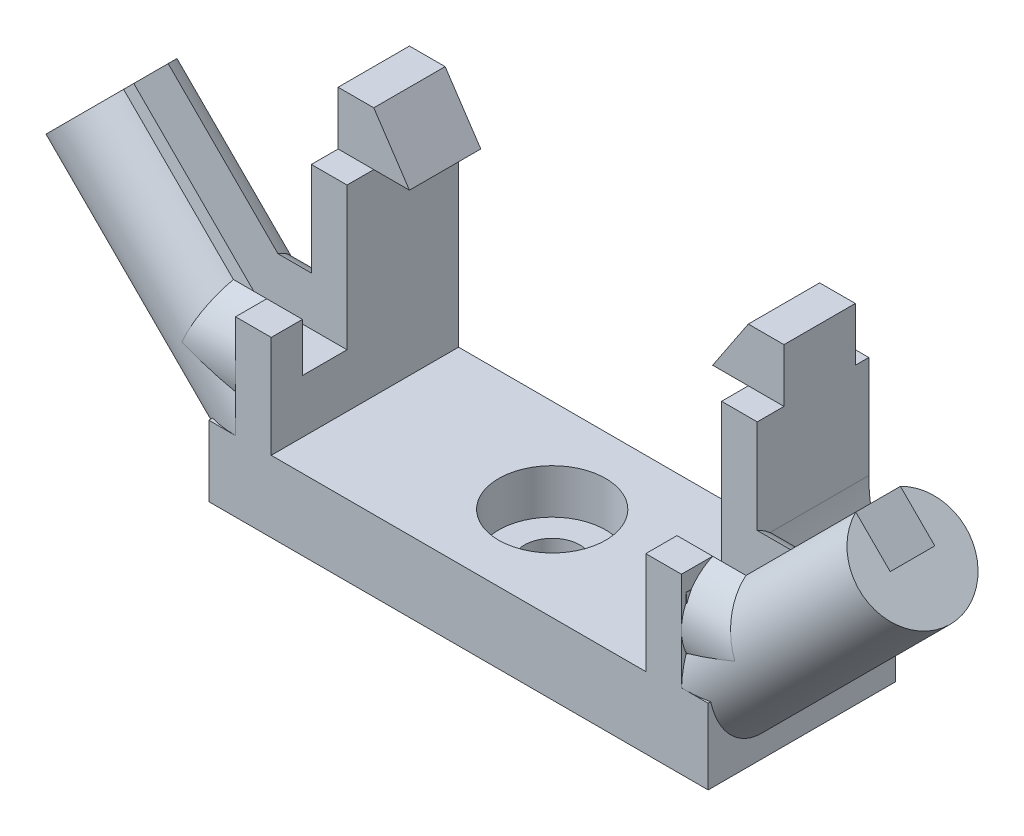
from build123d import *

# Parameters (mm, degrees)
SKETCH1_W                           = 28
SKETCH1_H                           = 15
BOSS_EXTRUDE1_DEPTH                 = 4
SKETCH2_W                           = 2
SKETCH2_H                           = 14
BOSS_EXTRUDE2_DEPTH                 = 2
SKETCH3_W                           = 2
SKETCH3_H                           = 11
BOSS_EXTRUDE3_DEPTH                 = 7.5
FILLET1_R                           = 10
CUT_EXTRUDE5_REACH                  = 33.313
CUT_EXTRUDE5_END_RADIUS             = 10
CUT_EXTRUDE5_DIRECTION_2_REACH      = 33.313
CUT_EXTRUDE5_DIRECTION_2_END_RADIUS = 10
BOSS_EXTRUDE4_DEPTH                 = 5
CUT_EXTRUDE6_DEPTH                  = 2
CUT_EXTRUDE6_DEPTH_BACK             = 15
SKETCH22_W                          = 21
SKETCH22_H                          = 5.222778623
BOSS_EXTRUDE6_START                 = -1.5
BOSS_EXTRUDE6_DEPTH                 = 1.75
CUT_EXTRUDE7_REACH                  = 43.938
SKETCH25_W                          = 4.745430675
SKETCH25_H                          = 15
CUT_EXTRUDE7_DIRECTION_2_REACH      = 43.938
SKETCH26_R                          = 1.55
CUT_EXTRUDE8_DEPTH                  = 4
SKETCH27_R                          = 3
CUT_EXTRUDE9_DEPTH                  = 2.5


with BuildPart() as part:
    # Sketch1 → Boss-Extrude1 (new body)
    with BuildSketch(Plane(origin=(0, 0, 0), x_dir=(1, 0, 0), z_dir=(0, 1, 0))):
        Rectangle(SKETCH1_W, SKETCH1_H)
    extrude(amount=BOSS_EXTRUDE1_DEPTH)

    # Sketch2 → Boss-Extrude2 (add, symmetric)
    with BuildSketch(Plane.XY):
        with Locations((-11.5, 11)):
            Rectangle(SKETCH2_W, SKETCH2_H)
        Polygon((-8.5, 15), (-10.5, 18), (-10.5, 15), align=None)
        Polygon((8.5, 15), (10.5, 15), (10.5, 18), align=None)
        with Locations((11.5, 11)):
            Rectangle(SKETCH2_W, SKETCH2_H)
    extrude(amount=BOSS_EXTRUDE2_DEPTH, both=True)

    # Sketch3 → Boss-Extrude3 (add, symmetric)
    with BuildSketch(Plane.XY):
        with Locations((-11.5, 9.5)):
            Rectangle(SKETCH3_W, SKETCH3_H)
        with Locations((11.5, 9.5)):
            Rectangle(SKETCH3_W, SKETCH3_H)
    extrude(amount=BOSS_EXTRUDE3_DEPTH, both=True)

    # Fillet1
    # the kernel refuses this fillet: 10 mm, written as the material it adds along each edge
    with BuildSketch(Plane(origin=(12.5, 4, -7.5), x_dir=(1, 0, 0), z_dir=(0, 0, 1))) as fillet1_piece_1:
        with BuildLine():
            CenterArc((10, 5.267826876), FILLET1_R, 180, 31.788330617)
            Line((0, 5.267826876), (-0.2, 5.267826876))
            Line((-0.2, 5.267826876), (-0.2, 0))
            Line((-0.2, 0), (0, -0.2))
            ThreePointArc((0, -0.2), (0.75, -0.2), (1.33, -0.105356538))
            Line((1.33, -0.105356538), (1.5, 0))
        make_face()
    extrude(amount=15)
    with BuildSketch(Plane(origin=(-12.5, 4, 7.5), x_dir=(0, 1, 0), z_dir=(0, 0, -1))) as fillet1_piece_2:
        with BuildLine():
            CenterArc((5.267826876, -10), FILLET1_R, 90, 31.788330617)
            Line((0, -1.5), (-0.105356538, -1.33))
            ThreePointArc((-0.105356538, -1.33), (-0.2, -0.75), (-0.2, 0))
            Line((-0.2, 0), (0, 0.2))
            Line((0, 0.2), (5.267826876, 0.2))
            Line((5.267826876, 0.2), (5.267826876, 0))
        make_face()
    extrude(amount=15)

    # Cut-Extrude5: up to this cylinder (the profile starts outside it)
    cut_extrude5_end = Plane(origin=(-22.5, 9.267826876, 5.390493), z_dir=(0, 0, -1)) * Cylinder(CUT_EXTRUDE5_END_RADIUS, 87.626, mode=Mode.PRIVATE)
    # Sketch13 → Cut-Extrude5 (cut, up to the surface)
    with BuildSketch(Plane(origin=(-10.5, 0, 0), x_dir=(0, 0, -1), z_dir=(1, 0, 0)), mode=Mode.PRIVATE) as cut_extrude5_sk1:
        Polygon((-3.5, 15), (-6, 15), (-7.5, 15), (-7.5, 8.718379218), (-6, 8.718379218), (-6, 7), (-3.5, 7), align=None)
    cut_extrude5_tool1 = extrude(cut_extrude5_sk1.sketch, amount=-CUT_EXTRUDE5_REACH, mode=Mode.PRIVATE) - cut_extrude5_end
    add(cut_extrude5_tool1.solids().sort_by_distance((-10.5, 11.275152, 5.390493))[0], mode=Mode.SUBTRACT)

    # Cut-Extrude5 direction 2: up to this cylinder (the profile starts outside it)
    cut_extrude5_direction_2_end = Plane(origin=(22.5, 9.267826876, 5.390493), z_dir=(0, 0, 1)) * Cylinder(CUT_EXTRUDE5_DIRECTION_2_END_RADIUS, 87.626, mode=Mode.PRIVATE)
    # Sketch13 → Cut-Extrude5 direction 2 (cut, up to the surface)
    with BuildSketch(Plane(origin=(-10.5, 0, 0), x_dir=(0, 0, -1), z_dir=(1, 0, 0)), mode=Mode.PRIVATE) as cut_extrude5_direction_2_sk1:
        Polygon((-3.5, 15), (-6, 15), (-7.5, 15), (-7.5, 8.718379218), (-6, 8.718379218), (-6, 7), (-3.5, 7), align=None)
    cut_extrude5_direction_2_tool1 = extrude(cut_extrude5_direction_2_sk1.sketch, amount=CUT_EXTRUDE5_DIRECTION_2_REACH, mode=Mode.PRIVATE) - cut_extrude5_direction_2_end
    add(cut_extrude5_direction_2_tool1.solids().sort_by_distance((-10.5, 11.275152, 5.390493))[0], mode=Mode.SUBTRACT)

    # Sketch14 → Boss-Extrude4 (add)
    with BuildSketch(Plane(origin=(-10.5, 0, 0), x_dir=(0, 0, -1), z_dir=(1, 0, 0))):
        with BuildLine():
            Line((-3.5, 9.727178029), (-3.5, 7))
            Line((-3.5, 7), (-6, 7))
            Line((-6, 7), (-6, 9.727178029))
            ThreePointArc((-6, 9.727178029), (-4.75, 4), (-3.5, 9.727178029))
        make_face()
    boss_extrude4 = extrude(amount=-BOSS_EXTRUDE4_DEPTH)

    # Sweep3: sweep along a path in Sketch17
    with BuildLine(Plane.XY.offset(5)) as sweep3_path:
        Line((-22.411313552, 14), (-11.517237777, 3.105924225))
    # Sketch21 → Sweep3 (sweep)
    with BuildSketch(Plane(origin=(-18.205656776, 18.205656776, 0), x_dir=(-0.7071067811865509, -0.7071067811865441, 0), z_dir=(0.7071067811865441, -0.7071067811865509, 0))):
        with BuildLine():
            Line((6.01040764, -6), (6.01040764, -3.5))
            Line((6.01040764, -3.5), (3.283229611, -3.5))
            ThreePointArc((3.283229611, -3.5), (9.01040764, -4.75), (3.283229611, -6))
            Line((3.283229611, -6), (6.01040764, -6))
        make_face()
    sweep3 = sweep(path=sweep3_path.line)

    # Mirror1: Boss-Extrude4, Sweep3 across plane
    add(boss_extrude4.mirror(Plane(origin=(0, 0, 0), x_dir=(0, 0, 1), z_dir=(1, 0, 0))))
    add(sweep3.mirror(Plane(origin=(0, 0, 0), x_dir=(0, 0, 1), z_dir=(1, 0, 0))))

    # Sketch22 → Cut-Extrude6 (cut, two sides: drawn at the far end of the back side and taken through both)
    with BuildSketch(Plane.XY.offset(7.5).offset(-CUT_EXTRUDE6_DEPTH_BACK)):
        with Locations((0, 6.611389311)):
            Rectangle(SKETCH22_W, SKETCH22_H)
    extrude(amount=CUT_EXTRUDE6_DEPTH + CUT_EXTRUDE6_DEPTH_BACK, mode=Mode.SUBTRACT)

    # Sketch24 → Boss-Extrude6 (add)
    with BuildSketch(Plane.XY.offset(7.5).offset(BOSS_EXTRUDE6_START)):
        Polygon((-10.5, 9.727178029), (-12.5, 9.727178029), (-12.5, 3.956694639), (-14, 3.956694639), (-14, 0), (14, 0), (14, 4.212052915), (12.5, 4.212052915), (12.5, 9.727178029), (10.5, 9.727178029), (10.5, 4), (-10.5, 4), align=None)
    extrude(amount=BOSS_EXTRUDE6_DEPTH)

    # Cut-Extrude7: up to this face of the body (flat: up to its plane)
    cut_extrude7_end = Plane(part.part.faces().sort_by_distance((14, 1.807333916, -0.907267183))[0])
    # Sketch25 → Cut-Extrude7 (cut, up to the picked face)
    with BuildSketch(Plane.ZY.offset(12.5), mode=Mode.PRIVATE) as cut_extrude7_sk1:
        with Locations((-5.127284663, 7.5)):
            Rectangle(SKETCH25_W, SKETCH25_H)
    cut_extrude7_tool1 = split(extrude(cut_extrude7_sk1.sketch, amount=-CUT_EXTRUDE7_REACH, mode=Mode.PRIVATE), bisect_by=cut_extrude7_end, keep=Keep.BOTH, mode=Mode.PRIVATE)
    add(cut_extrude7_tool1.solids().sort_by(Axis((-12.5, 7.5, -5.127285), (1, 0, 0)))[0], mode=Mode.SUBTRACT)

    # Cut-Extrude7 direction 2: up to this face of the body (flat: up to its plane)
    cut_extrude7_direction_2_end = Plane(part.part.faces().sort_by_distance((-14, 1.805327472, -0.914845046))[0])
    # Sketch25 → Cut-Extrude7 direction 2 (cut, up to the picked face)
    with BuildSketch(Plane.ZY.offset(12.5), mode=Mode.PRIVATE) as cut_extrude7_direction_2_sk1:
        with Locations((-5.127284663, 7.5)):
            Rectangle(SKETCH25_W, SKETCH25_H)
    cut_extrude7_direction_2_tool1 = split(extrude(cut_extrude7_direction_2_sk1.sketch, amount=CUT_EXTRUDE7_DIRECTION_2_REACH, mode=Mode.PRIVATE), bisect_by=cut_extrude7_direction_2_end, keep=Keep.BOTH, mode=Mode.PRIVATE)
    add(cut_extrude7_direction_2_tool1.solids().sort_by(Axis((-12.5, 7.5, -5.127285), (-1, 0, 0)))[0], mode=Mode.SUBTRACT)

    # Sketch26 → Cut-Extrude8 (cut)
    with BuildSketch(Plane(origin=(0, 4, 0), x_dir=(1, 0, 0), z_dir=(0, 1, 0))):
        with Locations(Location((0, -2.495430675, 0), (0, 0, 270))):
            Circle(SKETCH26_R)
    extrude(amount=-CUT_EXTRUDE8_DEPTH, mode=Mode.SUBTRACT)

    # Sketch27 → Cut-Extrude9 (cut)
    with BuildSketch(Plane(origin=(0, 4, 0), x_dir=(1, 0, 0), z_dir=(0, 1, 0))):
        with Locations(Location((0, -2.495430675, 0), (0, 0, 270))):
            Circle(SKETCH27_R)
    extrude(amount=-CUT_EXTRUDE9_DEPTH, mode=Mode.SUBTRACT)


solid = part.part
